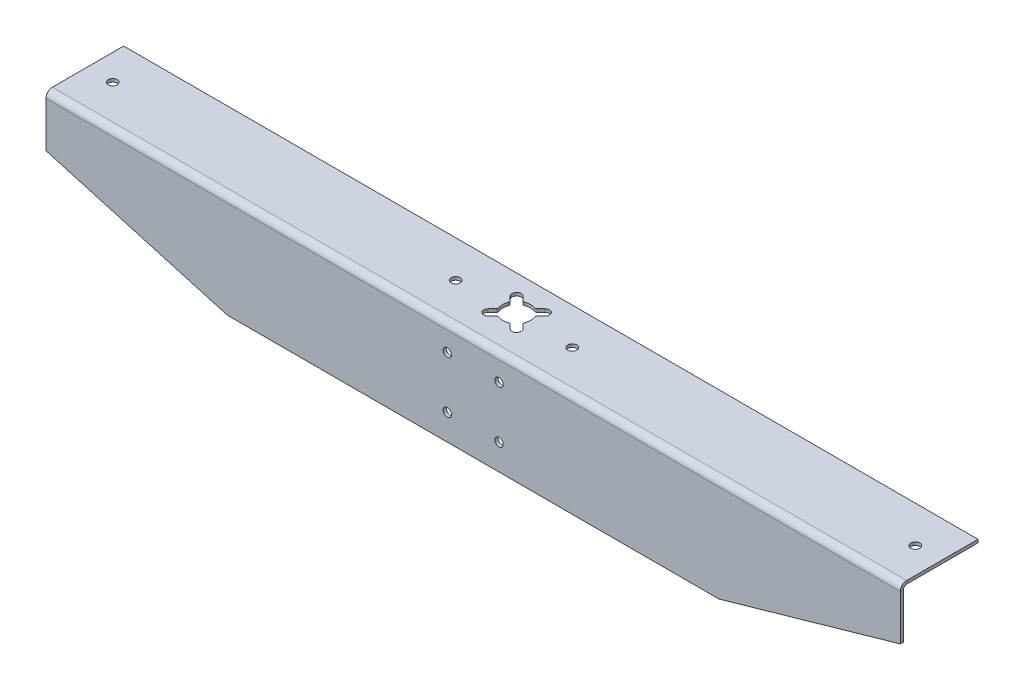
from build123d import *

# Parameters (mm, degrees)
SKETCH2_R                    = 1.6
BASE_FLANGE1_DEPTH           = 1.21412
EDGE_FLANGE1_STRIP_W         = 7.39648
EDGE_FLANGE1_STRIP_H         = 1.21412
EDGE_FLANGE1_STRIP_CUT_DEPTH = 330
EDGE_FLANGE1_DEPTH           = 330
CUT_EXTRUDE1_DEPTH           = 1.21412
SKETCH11_R                   = 1.75
CUT_EXTRUDE2_DEPTH           = 1.21412


# Sheet-metal steps are written as plain solids
with BuildPart() as part:
    # Sketch2 → Base-Flange1 (new body)
    with BuildSketch(Plane.XY):
        Polygon((-165, 0), (-165, 20), (165, 20), (165, 0), (95, -20), (-95, -20), align=None)
        with Locations((-10, 10)):
            Circle(SKETCH2_R, mode=Mode.SUBTRACT)
        with Locations((10, 10)):
            Circle(SKETCH2_R, mode=Mode.SUBTRACT)
        with Locations((10, -10)):
            Circle(SKETCH2_R, mode=Mode.SUBTRACT)
        with Locations((-10, -10)):
            Circle(SKETCH2_R, mode=Mode.SUBTRACT)
    extrude(amount=-BASE_FLANGE1_DEPTH)

    # Edge-Flange1 strip (across the edge) → Edge-Flange1 strip cut (cut)
    with BuildSketch(Plane(origin=(-165, 20, -1.21412), x_dir=(0, -1, 0), z_dir=(1, 0, 0))):
        with Locations((-1.21412, -0.60706)):
            Rectangle(EDGE_FLANGE1_STRIP_W, EDGE_FLANGE1_STRIP_H)
    extrude(amount=EDGE_FLANGE1_STRIP_CUT_DEPTH, mode=Mode.SUBTRACT)

    # Edge-Flange1 section (across the edge) → Edge-Flange1 (add)
    with BuildSketch(Plane(origin=(-165, 20, -1.21412), x_dir=(0, -1, 0), z_dir=(1, 0, 0))):
        with BuildLine():
            Line((0, 1.27), (0, 28.78588))
            Line((0, 28.78588), (1.21412, 28.78588))
            Line((1.21412, 28.78588), (1.21412, 1.27))
            ThreePointArc((1.21412, 1.27), (1.586094388, 0.371974388), (2.48412, 0))
            Line((2.48412, 0), (2.48412, -1.21412))
            ThreePointArc((2.48412, -1.21412), (0.727581903, -0.486538097), (0, 1.27))
        make_face()
    extrude(amount=EDGE_FLANGE1_DEPTH)

    # Sketch10 → Cut-Extrude1 (cut)
    with BuildSketch(Plane(origin=(0, 20, 0), x_dir=(1, 0, 0), z_dir=(0, 1, 0))):
        with BuildLine():
            Line((6.717514421, 21.028520687), (5.171899982, 19.482906248))
            ThreePointArc((5.171899982, 19.482906248), (4.968885146, 19.109755124), (5.001136207, 18.686179093))
            ThreePointArc((5.001136207, 18.686179093), (5.35, 16.78588), (5.001136207, 14.885580908))
            ThreePointArc((5.001136207, 14.885580908), (4.968885146, 14.462004877), (5.171899982, 14.088853753))
            Line((5.171899982, 14.088853753), (6.717514421, 12.543239313))
            ThreePointArc((6.717514421, 12.543239313), (6.717514421, 10.068365579), (4.242640687, 10.068365579))
            Line((4.242640687, 10.068365579), (2.697026248, 11.613980018))
            ThreePointArc((2.697026248, 11.613980018), (2.323875124, 11.816994854), (1.900299093, 11.784743793))
            ThreePointArc((1.900299093, 11.784743793), (0, 11.43588), (-1.900299092, 11.784743793))
            ThreePointArc((-1.900299092, 11.784743793), (-2.323875123, 11.816994854), (-2.697026247, 11.613980018))
            Line((-2.697026247, 11.613980018), (-4.242640687, 10.068365579))
            ThreePointArc((-4.242640687, 10.068365579), (-6.717514421, 10.068365579), (-6.717514421, 12.543239313))
            Line((-6.717514421, 12.543239313), (-5.171899982, 14.088853753))
            ThreePointArc((-5.171899982, 14.088853753), (-4.968885146, 14.462004877), (-5.001136207, 14.885580908))
            ThreePointArc((-5.001136207, 14.885580908), (-5.35, 16.78588), (-5.001136207, 18.686179093))
            ThreePointArc((-5.001136207, 18.686179093), (-4.968885146, 19.109755124), (-5.171899982, 19.482906248))
            Line((-5.171899982, 19.482906248), (-6.717514421, 21.028520687))
            ThreePointArc((-6.717514421, 21.028520687), (-6.717514421, 23.503394421), (-4.242640687, 23.503394421))
            Line((-4.242640687, 23.503394421), (-2.697026247, 21.957779982))
            ThreePointArc((-2.697026247, 21.957779982), (-2.323875123, 21.754765146), (-1.900299092, 21.787016207))
            ThreePointArc((-1.900299092, 21.787016207), (0, 22.13588), (1.900299093, 21.787016207))
            ThreePointArc((1.900299093, 21.787016207), (2.323875124, 21.754765146), (2.697026248, 21.957779982))
            Line((2.697026248, 21.957779982), (4.242640687, 23.503394421))
            ThreePointArc((4.242640687, 23.503394421), (6.717514421, 23.503394421), (6.717514421, 21.028520687))
        make_face()
    extrude(amount=-CUT_EXTRUDE1_DEPTH, mode=Mode.SUBTRACT)

    # Sketch11 → Cut-Extrude2 (cut)
    with BuildSketch(Plane(origin=(0, 20, 0), x_dir=(1, 0, 0), z_dir=(0, 1, 0))):
        with Locations(Location((-155, 15.78588, 0), (0, 0, 270))):
            Circle(SKETCH11_R)
        with Locations(Location((-22.5, 15.78588, 0), (0, 0, 270))):
            Circle(SKETCH11_R)
        with Locations(Location((22.5, 15.78588, 0), (0, 0, 270))):
            Circle(SKETCH11_R)
        with Locations(Location((155, 15.78588, 0), (0, 0, 270))):
            Circle(SKETCH11_R)
    extrude(amount=-CUT_EXTRUDE2_DEPTH, mode=Mode.SUBTRACT)


solid = part.part
